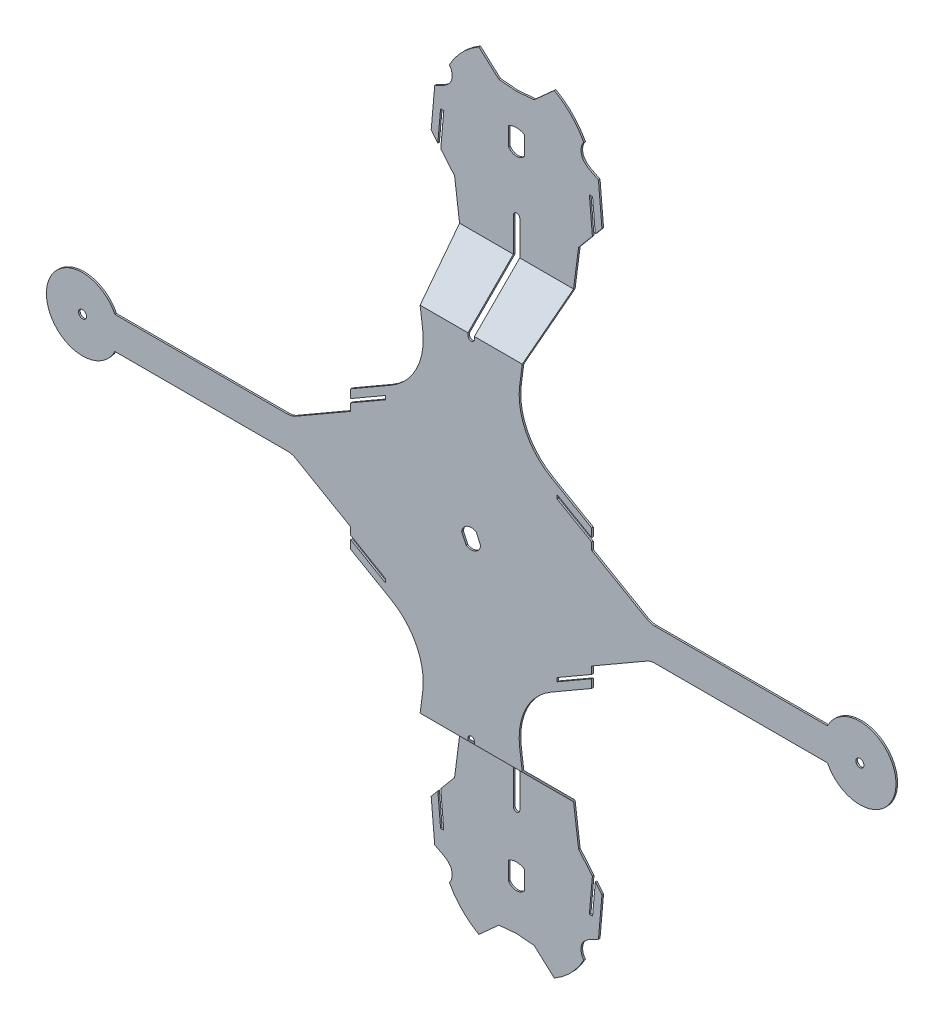
from build123d import *

# Parameters (mm, degrees)
SALIENTE_EXTRUIR1_DEPTH     = 271
CORTAR_EXTRUIR9_DEPTH       = 371.311303012
CORTAR_EXTRUIR9_DEPTH_BACK  = 371.311303012
CROQUIS4_R                  = 2.5
CORTAR_EXTRUIR10_DEPTH      = 371.311303012
CORTAR_EXTRUIR10_DEPTH_BACK = 371.311303012
CROQUIS2_W                  = 600.899293422
CROQUIS2_H                  = 554.061756016
REDONDEO1_R                 = 40
REDONDEO2_R                 = 10


with BuildPart() as part:
    # Croquis1 → Saliente-Extruir1 (new, symmetric)
    with BuildSketch(Plane(origin=(0, 0, 0), x_dir=(0, 0, -1), z_dir=(1, 0, 0))):
        Polygon((17.5, 0), (17.5, 110), (45.748915908, 138.248915908), (45.748915908, 248), (46.748915908, 248), (46.748915908, 137.834702346), (18.5, 109.585786438), (18.5, 0), (18.5, -109.585786438), (46.748915908, -137.834702346), (46.748915908, -248), (45.748915908, -248), (45.748915908, -138.248915908), (17.5, -110), align=None)
    extrude(amount=SALIENTE_EXTRUIR1_DEPTH, both=True)

    # Croquis4 → Cortar-Extruir9 (cut, two sides: drawn at the far end of the back side and taken through both)
    with BuildSketch(Plane.XY.offset(-CORTAR_EXTRUIR9_DEPTH_BACK)):
        with Locations((-242, 0)):
            Circle(CROQUIS4_R)
        with Locations((242, 0)):
            Circle(CROQUIS4_R)
        with BuildLine():
            Line((-5, 201.31662479), (-5, 194.68337521))
            ThreePointArc((-5, 194.68337521), (0, 192), (5, 194.68337521))
            Line((5, 194.68337521), (5, 201.31662479))
            Line((5, 201.31662479), (5, 206.077747211))
            ThreePointArc((5, 206.077747211), (0, 207.5), (-5, 206.077747211))
            Line((-5, 206.077747211), (-5, 201.31662479))
        make_face()
        with BuildLine():
            Line((5, -201.31662479), (5, -194.68337521))
            Line((5, -194.68337521), (5, -189.922252789))
            ThreePointArc((5, -189.922252789), (0, -188.5), (-5, -189.922252789))
            Line((-5, -189.922252789), (-5, -194.68337521))
            Line((-5, -194.68337521), (-5, -201.31662479))
            ThreePointArc((-5, -201.31662479), (0, -204), (5, -201.31662479))
        make_face()
        with BuildLine():
            Line((-5.933205139, 0.892791565), (-3.129872731, -5.118974183))
            ThreePointArc((-3.129872731, -5.118974183), (2.53570957, -5.437846722), (5.933205139, -0.892791565))
            Line((5.933205139, -0.892791565), (3.129872731, 5.118974183))
            ThreePointArc((3.129872731, 5.118974183), (-2.53570957, 5.437846722), (-5.933205139, 0.892791565))
        make_face()
    extrude(amount=CORTAR_EXTRUIR9_DEPTH + CORTAR_EXTRUIR9_DEPTH_BACK, mode=Mode.SUBTRACT)

    # Croquis2 → Cortar-Extruir10 (cut, two sides: drawn at the far end of the back side and taken through both)
    # profile 1 of 3: a face of its own
    with BuildSketch(Plane.XY.offset(-CORTAR_EXTRUIR10_DEPTH_BACK)):
        Rectangle(CROQUIS2_W, CROQUIS2_H)
        with BuildLine():
            Line((-49.023071172, 174.670813412), (-53.168424061, 179.61105261))
            Line((-53.168424061, 179.61105261), (-50.970090866, 204.738116011))
            add(Edge.make_bspline(
                [(-50.970090866, 204.738116011), (-47.792962615, 206.268732201), (-40.787060156, 209.02456014), (-39.883059345, 216.418425991), (-40.736802152, 219.176084752), (-41.896759663, 220.381052918)],
                knots=[0, 0, 0, 0, 0.610720728, 0.773572895, 1, 1, 1, 1], degree=3))
            ThreePointArc((-41.896759663, 220.381052918), (-34.036336447, 231.13273006), (-23.5, 239.279534881))
            Line((-23.5, 239.279534881), (-11, 228.04191018))
            Line((-11, 228.04191018), (0, 227.079534881))
            Line((0, 227.079534881), (11, 228.04191018))
            Line((11, 228.04191018), (23.5, 239.279534881))
            ThreePointArc((23.5, 239.279534881), (34.036336447, 231.13273006), (41.896759663, 220.381052918))
            add(Edge.make_bspline(
                [(50.970090866, 204.738116011), (47.792962615, 206.268732201), (40.787060156, 209.02456014), (39.883059345, 216.418425991), (40.736802152, 219.176084752), (41.896759663, 220.381052918)],
                knots=[0, 0, 0, 0, 0.610720728, 0.773572895, 1, 1, 1, 1], degree=3))
            Line((50.970090866, 204.738116011), (53.168424061, 179.61105261))
            Line((53.168424061, 179.61105261), (49.023071172, 174.670813412))
            Line((49.023071172, 174.670813412), (47.331626671, 194.00411253))
            Line((47.331626671, 194.00411253), (45.323986996, 194.00411253))
            Line((45.323986996, 194.00411253), (47.204993262, 172.50411253))
            Line((47.204993262, 172.50411253), (38.602496631, 162.252056265))
            Line((38.602496631, 162.252056265), (26.75, 71.158420678))
            Line((26.75, 71.158420678), (75, 43.301270189))
            Line((75, 43.301270189), (75, 38.035835734))
            Line((75, 38.035835734), (53.5, 50.448866522))
            Line((53.5, 50.448866522), (53.5, 48.139465445))
            Line((53.5, 48.139465445), (75, 35.726434657))
            Line((75, 35.726434657), (75, 31.166434657))
            Line((75, 31.166434657), (111.661340242, 10))
            Line((111.661340242, 10), (221.844355629, 10))
            ThreePointArc((221.844355629, 10), (264.5, 0), (221.844355629, -10))
            Line((221.844355629, -10), (111.661340242, -10))
            Line((111.661340242, -10), (75, -31.166434657))
            Line((75, -31.166434657), (75, -35.726434657))
            Line((75, -35.726434657), (53.5, -48.139465445))
            Line((53.5, -48.139465445), (53.5, -50.448866522))
            Line((53.5, -50.448866522), (75, -38.035835734))
            Line((75, -38.035835734), (75, -43.301270189))
            Line((75, -43.301270189), (26.75, -71.158420678))
            Line((26.75, -71.158420678), (38.602496631, -162.252056265))
            Line((38.602496631, -162.252056265), (47.204993262, -172.50411253))
            Line((47.204993262, -172.50411253), (45.323986996, -194.00411253))
            Line((45.323986996, -194.00411253), (47.331626671, -194.00411253))
            Line((47.331626671, -194.00411253), (49.023071172, -174.670813412))
            Line((49.023071172, -174.670813412), (53.168424061, -179.61105261))
            Line((53.168424061, -179.61105261), (50.970090866, -204.738116011))
            add(Edge.make_bspline(
                [(50.970090866, -204.738116011), (47.792962615, -206.268732201), (40.787060156, -209.02456014), (39.883059345, -216.418425991), (40.736802152, -219.176084752), (41.896759663, -220.381052918)],
                knots=[0, 0, 0, 0, 0.610720728, 0.773572895, 1, 1, 1, 1], degree=3))
            ThreePointArc((41.896759663, -220.381052918), (34.036336447, -231.13273006), (23.5, -239.279534881))
            Line((23.5, -239.279534881), (11, -228.04191018))
            Line((11, -228.04191018), (0, -227.079534881))
            Line((0, -227.079534881), (-11, -228.04191018))
            Line((-11, -228.04191018), (-23.5, -239.279534881))
            ThreePointArc((-23.5, -239.279534881), (-34.036336447, -231.13273006), (-41.896759663, -220.381052918))
            add(Edge.make_bspline(
                [(-50.970090866, -204.738116011), (-47.792962615, -206.268732201), (-40.787060156, -209.02456014), (-39.883059345, -216.418425991), (-40.736802152, -219.176084752), (-41.896759663, -220.381052918)],
                knots=[0, 0, 0, 0, 0.610720728, 0.773572895, 1, 1, 1, 1], degree=3))
            Line((-50.970090866, -204.738116011), (-53.168424061, -179.61105261))
            Line((-53.168424061, -179.61105261), (-49.023071172, -174.670813412))
            Line((-49.023071172, -174.670813412), (-47.331626671, -194.00411253))
            Line((-47.331626671, -194.00411253), (-45.323986996, -194.00411253))
            Line((-45.323986996, -194.00411253), (-47.204993262, -172.50411253))
            Line((-47.204993262, -172.50411253), (-38.602496631, -162.252056265))
            Line((-38.602496631, -162.252056265), (-26.75, -71.158420678))
            Line((-26.75, -71.158420678), (-75, -43.301270189))
            Line((-75, -43.301270189), (-75, -38.035835734))
            Line((-75, -38.035835734), (-53.5, -50.448866522))
            Line((-53.5, -50.448866522), (-53.5, -48.139465445))
            Line((-53.5, -48.139465445), (-75, -35.726434657))
            Line((-75, -35.726434657), (-75, -31.166434657))
            Line((-75, -31.166434657), (-111.661340242, -10))
            Line((-111.661340242, -10), (-221.844355629, -10))
            ThreePointArc((-221.844355629, -10), (-264.5, 0), (-221.844355629, 10))
            Line((-221.844355629, 10), (-111.661340242, 10))
            Line((-111.661340242, 10), (-75, 31.166434657))
            Line((-75, 31.166434657), (-75, 35.726434657))
            Line((-75, 35.726434657), (-53.5, 48.139465445))
            Line((-53.5, 48.139465445), (-53.5, 50.448866522))
            Line((-53.5, 50.448866522), (-75, 38.035835734))
            Line((-75, 38.035835734), (-75, 43.301270189))
            Line((-75, 43.301270189), (-26.75, 71.158420678))
            Line((-26.75, 71.158420678), (-38.602496631, 162.252056265))
            Line((-38.602496631, 162.252056265), (-47.204993262, 172.50411253))
            Line((-47.204993262, 172.50411253), (-45.323986996, 194.00411253))
            Line((-45.323986996, 194.00411253), (-47.331626671, 194.00411253))
            Line((-47.331626671, 194.00411253), (-49.023071172, 174.670813412))
        make_face(mode=Mode.SUBTRACT)
    # profile 2 of 3: a face of its own
    with BuildSketch(Plane.XY.offset(-CORTAR_EXTRUIR10_DEPTH_BACK)):
        with BuildLine():
            ThreePointArc((2, -108.5), (0, -106.5), (-2, -108.5))
            Line((-2, -108.5), (-2, -159.5))
            ThreePointArc((-2, -159.5), (0, -161.5), (2, -159.5))
            Line((2, -159.5), (2, -108.5))
        make_face()
    # profile 3 of 3: a face of its own
    with BuildSketch(Plane.XY.offset(-CORTAR_EXTRUIR10_DEPTH_BACK)):
        with BuildLine():
            Line((-2, 159.5), (-2, 108.5))
            ThreePointArc((-2, 108.5), (0, 106.5), (2, 108.5))
            Line((2, 108.5), (2, 159.5))
            ThreePointArc((2, 159.5), (0, 161.5), (-2, 159.5))
        make_face()
    extrude(amount=CORTAR_EXTRUIR10_DEPTH + CORTAR_EXTRUIR10_DEPTH_BACK, mode=Mode.SUBTRACT)

    # Redondeo1
    redondeo1_edges = [part.edges().sort_by_distance(p)[0] for p in [
        (26.75, -71.158420678, -18),
        (-26.75, -71.158420678, -18),
        (-26.75, 71.158420678, -18),
        (26.75, 71.158420678, -18),
    ]]
    fillet(redondeo1_edges, radius=REDONDEO1_R)

    # Redondeo2
    redondeo2_edges = [part.edges().sort_by_distance(p)[0] for p in [
        (-111.661340242, -10, -18),
        (-111.661340242, 10, -18),
        (111.661340242, -10, -18),
        (111.661340242, 10, -18),
    ]]
    fillet(redondeo2_edges, radius=REDONDEO2_R)


solid = part.part
